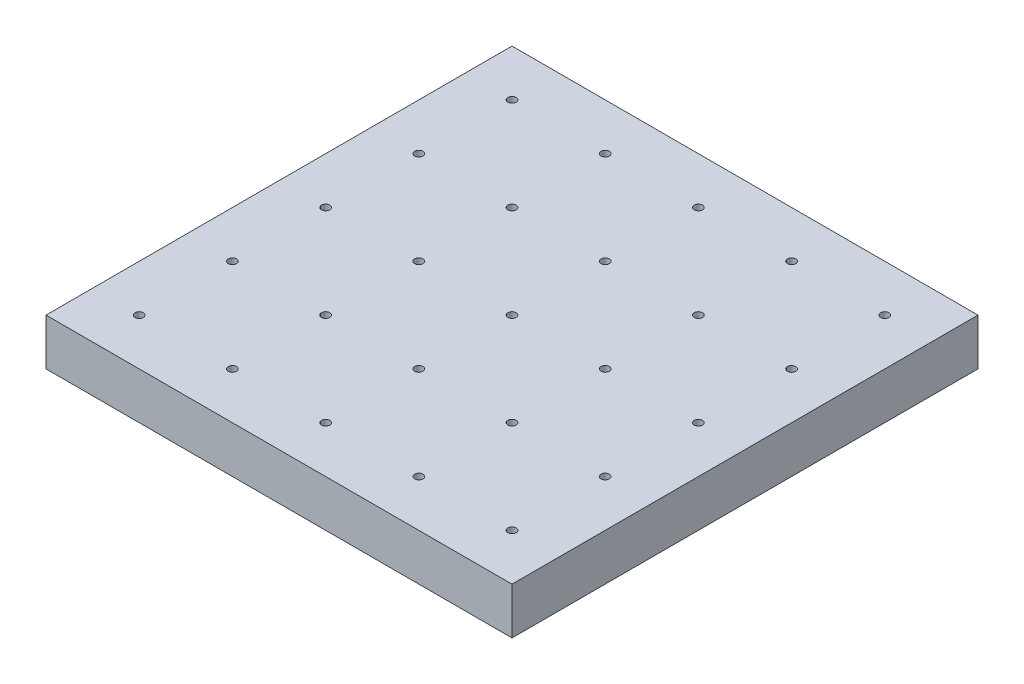
from build123d import *

# Parameters (mm, degrees)
SKETCH1_W             = 127
SKETCH1_H             = 127
BOSS_EXTRUDE1_DEPTH   = 12.7
F_4_40_TAPPED_HOLE1_D = 2.2606
LPATTERN1_COUNT       = 5
LPATTERN1_PITCH       = 25.4
LPATTERN1_COUNT_DIR2  = 5
LPATTERN1_PITCH_DIR2  = 25.4


with BuildPart() as part:
    # Sketch1 → Boss-Extrude1 (new body)
    with BuildSketch(Plane(origin=(0, 0, 0), x_dir=(1, 0, 0), z_dir=(0, 1, 0))):
        Rectangle(SKETCH1_W, SKETCH1_H)
    extrude(amount=BOSS_EXTRUDE1_DEPTH)

    # #4-40 Tapped Hole1 (through all)
    with Locations(Plane(origin=(50.8, 12.7, 50.8), x_dir=(0, 0, 1), z_dir=(0, 1, 0))):
        with Locations((0, 0)):
            f_4_40_tapped_hole1 = Hole(F_4_40_TAPPED_HOLE1_D / 2)

    # LPattern1: 4-40 Tapped Hole1 5 × 5
    with Locations(*[(-i * LPATTERN1_PITCH, 0, -j * LPATTERN1_PITCH_DIR2) for i in range(LPATTERN1_COUNT) for j in range(LPATTERN1_COUNT_DIR2) if (i, j) != (0, 0)]):
        add(f_4_40_tapped_hole1, mode=Mode.SUBTRACT)


solid = part.part
